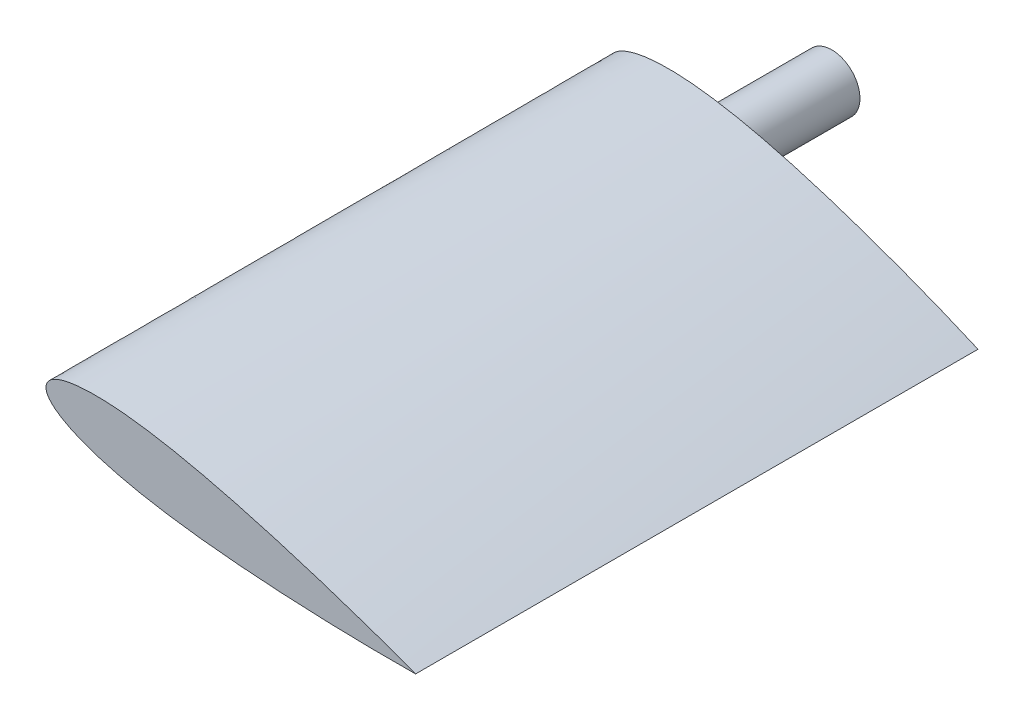
from build123d import *

# Parameters (mm, degrees)
SKETCH_4_R        = 50
EXTRUDE_1_DEPTH   = 200
MOVE_BODY_1_ANGLE = 10


with BuildPart() as part:
    # 放样1: read off the stored shape, not the designer's step
    # 放样1: loft between two sections, ruled curve by curve
    loft_1_from = [
        Edge.make_bspline([(666.999999998, 0, 1000), (663.799637222, -0.604724548, 1000), (656.220345397, -2.022885982, 1000), (645.979516294, -3.898542902, 1000), (635.247963028, -5.826243875, 1000), (624.819981281, -7.662584434, 1000), (614.198521539, -9.496021813, 1000), (599.972074061, -11.904629718, 1000), (582.430830371, -14.787740297, 1000), (561.135044503, -18.155812197, 1000), (539.946417674, -21.377647562, 1000), (518.671869989, -24.487157927, 1000), (497.416172992, -27.468442034, 1000), (476.123475264, -30.32944244, 1000), (454.824744619, -33.062783586, 1000), (433.50415239, -35.666455969, 1000), (412.170012578, -38.132804161, 1000), (390.818267621, -40.453999041, 1000), (369.450759947, -42.619108718, 1000), (348.066446531, -44.61511771, 1000), (326.665801057, -46.426441856, 1000), (305.24879013, -48.034169355, 1000), (283.816053008, -49.416509673, 1000), (262.368394512, -50.54750092, 1000), (240.907772126, -51.396721383, 1000), (219.436549528, -51.928303079, 1000), (201.539164161, -52.070683511, 1000), (187.221095545, -51.978850226, 1000), (176.483975584, -51.799236258, 1000), (165.749412964, -51.500531623, 1000), (155.01932189, -51.073159695, 1000), (144.295530458, -50.506856143, 1000), (133.580710906, -49.789673503, 1000), (122.878050961, -48.907360236, 1000), (112.192125096, -47.843447663, 1000), (101.527781752, -46.578273412, 1000), (90.892670861, -45.089586686, 1000), (80.294429011, -43.348017915, 1000), (69.750642268, -41.316102027, 1000), (59.27225592, -38.947539372, 1000), (50.626877349, -36.641275533, 1000), (43.777772332, -34.54819846, 1000), (38.687572512, -32.840917397, 1000), (33.65117684, -30.975832975, 1000), (28.686664939, -28.92949158, 1000), (23.813093939, -26.671460223, 1000), (19.064458401, -24.161974773, 1000), (14.487509708, -21.346794417, 1000), (10.161987345, -18.156904498, 1000), (6.218399789, -14.494122288, 1000), (2.887973837, -10.257639927, 1000), (0.554665428, -5.36560271, 1000), (-0.00056538, -1.793819625, 1000), (0, 0, 1000)], [0, 0, 0, 0, 0.015625, 0.03125, 0.046875, 0.0625, 0.078125, 0.09375, 0.125, 0.15625, 0.1875, 0.21875, 0.25, 0.28125, 0.3125, 0.34375, 0.375, 0.40625, 0.4375, 0.46875, 0.5, 0.53125, 0.5625, 0.59375, 0.625, 0.65625, 0.6875, 0.703125, 0.71875, 0.734375, 0.75, 0.765625, 0.78125, 0.796875, 0.8125, 0.828125, 0.84375, 0.859375, 0.875, 0.890625, 0.90625, 0.9140625, 0.921875, 0.9296875, 0.9375, 0.9453125, 0.953125, 0.9609375, 0.96875, 0.9765625, 0.984375, 0.9921875, 1, 1, 1, 1], 3),
        Edge.make_bspline([(0, 0, 1000), (-0.00056538, 1.793819625, 1000), (0.554665457, 5.365602719, 1000), (2.887973782, 10.257639911, 1000), (6.218399893, 14.494122319, 1000), (10.16198715, 18.156904441, 1000), (14.487510113, 21.346794535, 1000), (19.064457581, 24.161974532, 1000), (23.813095456, 26.671460667, 1000), (28.686661745, 28.929490645, 1000), (33.651182789, 30.975834716, 1000), (38.687562847, 32.840914568, 1000), (43.77777737, 34.548199936, 1000), (50.627004326, 36.641312682, 1000), (59.272176198, 38.947516048, 1000), (69.75068889, 41.316115667, 1000), (80.294402937, 43.348010287, 1000), (90.892684893, 45.089590791, 1000), (101.527774389, 46.578271259, 1000), (112.192129243, 47.843448873, 1000), (122.878048588, 48.907359547, 1000), (133.580712133, 49.789673852, 1000), (144.295529784, 50.506855964, 1000), (155.019322303, 51.073159781, 1000), (165.7494126, 51.500531586, 1000), (176.483976098, 51.799236258, 1000), (187.221094044, 51.978850255, 1000), (201.539174789, 52.070683467, 1000), (219.436542978, 51.928303134, 1000), (240.907775179, 51.396721346, 1000), (262.368393037, 50.54750093, 1000), (283.816053471, 49.416509703, 1000), (305.248790507, 48.034169261, 1000), (326.665799717, 46.426442055, 1000), (348.066449966, 44.615117246, 1000), (369.450753442, 42.619109596, 1000), (390.818280118, 40.453997321, 1000), (412.169989323, 38.132807449, 1000), (433.504199323, 35.666449175, 1000), (454.824640648, 33.062798963, 1000), (476.123661756, 30.329414262, 1000), (497.415809346, 27.468498036, 1000), (518.672557556, 24.487049873, 1000), (539.945247415, 21.377835197, 1000), (561.137421083, 18.155424744, 1000), (582.426549093, 14.788450701, 1000), (599.977986088, 11.903627109, 1000), (614.193135953, 9.496953161, 1000), (624.809385208, 7.66440837, 1000), (635.248408041, 5.826192456, 1000), (645.979996559, 3.898441222, 1000), (656.220005166, 2.022955598, 1000), (663.799637221, 0.604724548, 1000), (666.999999998, 0, 1000)], [0, 0, 0, 0, 0.0078125, 0.015625, 0.0234375, 0.03125, 0.0390625, 0.046875, 0.0546875, 0.0625, 0.0703125, 0.078125, 0.0859375, 0.09375, 0.109375, 0.125, 0.140625, 0.15625, 0.171875, 0.1875, 0.203125, 0.21875, 0.234375, 0.25, 0.265625, 0.28125, 0.296875, 0.3125, 0.34375, 0.375, 0.40625, 0.4375, 0.46875, 0.5, 0.53125, 0.5625, 0.59375, 0.625, 0.65625, 0.6875, 0.71875, 0.75, 0.78125, 0.8125, 0.84375, 0.875, 0.90625, 0.921875, 0.9375, 0.953125, 0.96875, 0.984375, 1, 1, 1, 1], 3),
    ]
    loft_1_to = [
        Edge.make_bspline([(667, 0, 0), (663.787937121, -0.778122232, 0), (656.200450193, -2.598380354, 0), (645.874703604, -5.022316958, 0), (635.152751042, -7.491793756, 0), (624.5656651, -9.880168768, 0), (613.932901468, -12.233182769, 0), (599.674290652, -15.325646654, 0), (581.992397773, -19.049903866, 0), (560.57943939, -23.387245223, 0), (539.221710022, -27.546205859, 0), (517.787201902, -31.556421716, 0), (496.348785222, -35.404191447, 0), (474.869299834, -39.09532252, 0), (453.369610223, -42.622057623, 0), (431.838824667, -45.980159867, 0), (410.283069511, -49.159666954, 0), (388.699054607, -52.149437047, 0), (367.088216437, -54.934513775, 0), (345.449452769, -57.497118306, 0), (323.783329406, -59.815457029, 0), (302.089797679, -61.863709181, 0), (280.370013167, -63.611758836, 0), (258.625333152, -65.023318773, 0), (236.859716284, -66.056526685, 0), (215.07684211, -66.660710105, 0), (196.918876775, -66.757547051, 0), (182.392533714, -66.55498137, 0), (171.501404926, -66.251902277, 0), (160.617518552, -65.786531136, 0), (149.742132912, -65.14508538, 0), (138.876506323, -64.313782442, 0), (128.032113187, -63.275126167, 0), (117.209580934, -62.009887151, 0), (106.420382287, -60.495066539, 0), (95.672322051, -58.704678377, 0), (84.980781239, -56.605895334, 0), (74.36207887, -54.160061058, 0), (63.842374932, -51.318325944, 0), (53.456401835, -48.016417607, 0), (44.957838639, -44.813840559, 0), (38.292062891, -41.923609068, 0), (33.377232896, -39.572370085, 0), (28.56486913, -37.018085304, 0), (23.883463681, -34.231740425, 0), (19.36150864, -31.18432115, 0), (15.060271723, -27.837579504, 0), (11.041020644, -24.153267514, 0), (7.406069775, -20.084935176, 0), (4.290999374, -15.600598491, 0), (1.871979479, -10.701125876, 0), (0.340748863, -5.445801038, 0), (-0.000762063, -1.818923188, 0), (0, 0, 0)], [0, 0, 0, 0, 0.015625, 0.03125, 0.046875, 0.0625, 0.078125, 0.09375, 0.125, 0.15625, 0.1875, 0.21875, 0.25, 0.28125, 0.3125, 0.34375, 0.375, 0.40625, 0.4375, 0.46875, 0.5, 0.53125, 0.5625, 0.59375, 0.625, 0.65625, 0.6875, 0.703125, 0.71875, 0.734375, 0.75, 0.765625, 0.78125, 0.796875, 0.8125, 0.828125, 0.84375, 0.859375, 0.875, 0.890625, 0.90625, 0.9140625, 0.921875, 0.9296875, 0.9375, 0.9453125, 0.953125, 0.9609375, 0.96875, 0.9765625, 0.984375, 0.9921875, 1, 1, 1, 1], 3),
        Edge.make_bspline([(0, 0, 0), (-0.000762063, 1.818923188, 0), (0.340748548, 5.445800771, 0), (1.871980086, 10.701126391, 0), (4.290998372, 15.600597641, 0), (7.406071183, 20.084936371, 0), (11.041021844, 24.15326852, 0), (15.060236322, 27.837549592, 0), (19.361493058, 31.184307985, 0), (23.883478049, 34.231752566, 0), (28.564877292, 37.018092199, 0), (33.377225985, 39.572364244, 0), (38.292059332, 41.923606062, 0), (44.957845322, 44.81384621, 0), (53.456396907, 48.016413426, 0), (63.842377593, 51.318328228, 0), (74.36207734, 54.160059689, 0), (84.980781846, 56.605896032, 0), (95.6723223, 58.704678198, 0), (106.420381084, 60.495066274, 0), (117.209583402, 62.009887926, 0), (128.03211035, 63.275124839, 0), (138.876497485, 64.313783504, 0), (149.742260365, 65.145092619, 0), (160.617583681, 65.786535028, 0), (171.501366862, 66.251900805, 0), (182.392509333, 66.554980024, 0), (196.91891222, 66.75754823, 0), (215.076816077, 66.660709555, 0), (236.859730532, 66.056526855, 0), (258.625324823, 65.023318727, 0), (280.370017887, 63.611758862, 0), (302.089795835, 61.863709105, 0), (323.783329573, 59.815457216, 0), (345.449454995, 57.497117841, 0), (367.088211422, 54.934514671, 0), (388.699064902, 52.149435238, 0), (410.283049885, 49.15967045, 0), (431.83886648, 45.980152247, 0), (453.369533879, 42.622071814, 0), (474.869445862, 39.095294769, 0), (496.348540372, 35.404238832, 0), (517.787684284, 31.556326568, 0), (539.220784537, 27.546391723, 0), (560.581135329, 23.386898456, 0), (581.988814982, 19.050650465, 0), (599.680611516, 15.324311348, 0), (613.932935101, 12.233157769, 0), (624.565379788, 9.880240812, 0), (635.152932724, 7.491748581, 0), (645.874603859, 5.02234186, 0), (656.200501376, 2.598367496, 0), (663.787937121, 0.778122232, 0), (667, 0, 0)], [0, 0, 0, 0, 0.0078125, 0.015625, 0.0234375, 0.03125, 0.0390625, 0.046875, 0.0546875, 0.0625, 0.0703125, 0.078125, 0.0859375, 0.09375, 0.109375, 0.125, 0.140625, 0.15625, 0.171875, 0.1875, 0.203125, 0.21875, 0.234375, 0.25, 0.265625, 0.28125, 0.296875, 0.3125, 0.34375, 0.375, 0.40625, 0.4375, 0.46875, 0.5, 0.53125, 0.5625, 0.59375, 0.625, 0.65625, 0.6875, 0.71875, 0.75, 0.78125, 0.8125, 0.84375, 0.875, 0.90625, 0.921875, 0.9375, 0.953125, 0.96875, 0.984375, 1, 1, 1, 1], 3),
    ]
    loft_1 = Solid(Shell([*[Face.make_surface_from_curves(loft_1_from[k], loft_1_to[k]) for k in range(2)], Face(Wire(loft_1_from)), Face(Wire(loft_1_to))]))
    add(loft_1)

    # 草图4 → 凸台-拉伸1 (add)
    with BuildSketch(Plane(origin=(0, 0, 0), x_dir=(-1, 0, 0), z_dir=(0, 0, -1))):
        with Locations((-200, 0)):
            Circle(SKETCH_4_R)
    extrude(amount=EXTRUDE_1_DEPTH)


with BuildPart() as part_1:
    # Move Body 1: moved
    add(part.part.rotate(Axis((333.49958875, 7.784e-06, 0), (0, 0, -1)), MOVE_BODY_1_ANGLE))


solid = part_1.part
